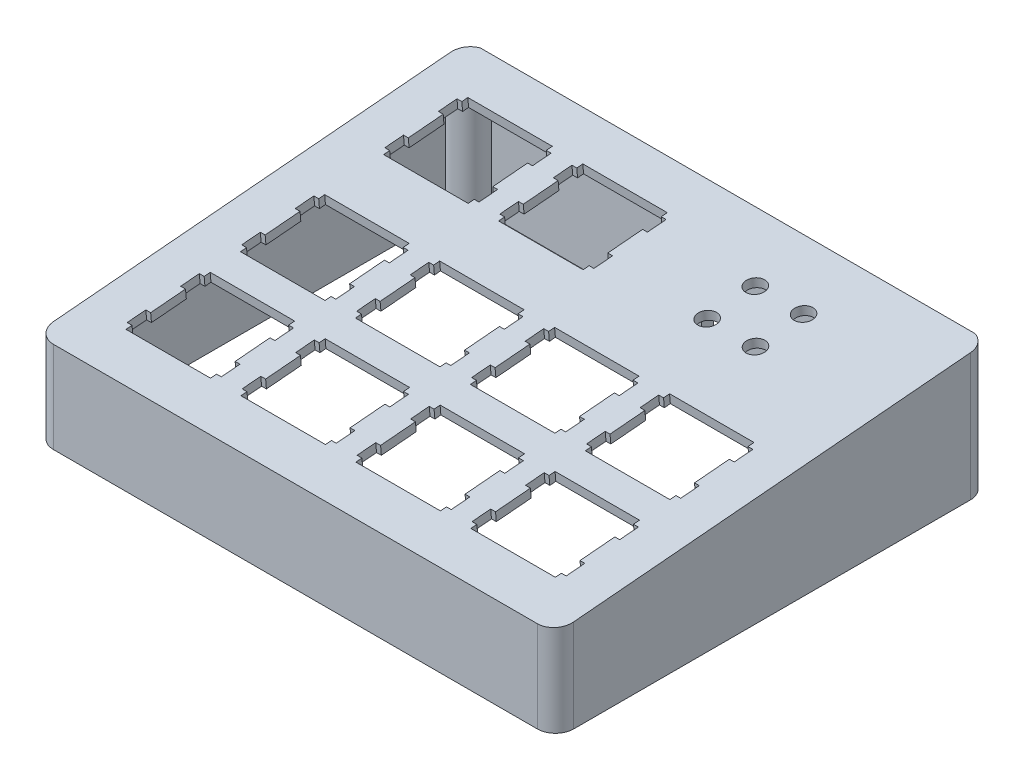
from build123d import *

# Parameters (mm, degrees)
SKETCH2_W                     = 86.201
SKETCH2_H                     = 71.913
BOSS_EXTRUDE1_DEPTH           = 0.75
CUT_EXTRUDE1_REACH            = 58.316
SKETCH7_R                     = 1.5635
EXTRUDE_THIN1_REACH           = 62.021
SKETCH3_W                     = 86.201
SKETCH3_H                     = 71.770082938
SKETCH3_W_2                   = 82.201
SKETCH3_H_2                   = 67.770082938
FILLET1_R                     = 3
BOSS_EXTRUDE2_REACH           = 62.021
SKETCH4_R                     = 3
TAP_DRILL_FOR_2_56_TAP1_D     = 1.778
TAP_DRILL_FOR_2_56_TAP1_DEPTH = 12.7
TAP_DRILL_FOR_2_56_TAP1_TIP   = 0.53416509
CUT_EXTRUDE2_REACH            = 87.527


with BuildPart() as part:
    # Sketch2 → Boss-Extrude1 (new, symmetric)
    with BuildSketch(Plane(origin=(0, 0, 0), x_dir=(1, 0, 0), z_dir=(0, 0.9961946980917455, 0.08715574274765836))):
        Rectangle(SKETCH2_W, SKETCH2_H)
    extrude(amount=BOSS_EXTRUDE1_DEPTH, both=True)

    # Sketch7 → Cut-Extrude1 (cut, up to next)
    with BuildSketch(Plane(origin=(0, 0.747146024, 0.065366807), x_dir=(1, 0, 0), z_dir=(0, 0.9961946980917457, 0.08715574274765837)), mode=Mode.PRIVATE) as cut_extrude1_sk1:
        Polygon((16.524502256, -15.430498458), (16.524502256, -14.43049843), (2.52450187, -14.43049843), (2.52450187, -15.430498458), (1.724502611, -15.430498458), (1.724502611, -18.530497017), (2.52450187, -18.530497017), (2.52450187, -24.330500229), (1.724502611, -24.330500229), (1.724502611, -27.430498788), (2.52450187, -27.430498788), (2.52450187, -28.430498816), (16.524502256, -28.430498816), (16.524502256, -27.430498788), (17.32450533, -27.430498788), (17.32450533, -24.330500229), (16.524502256, -24.330500229), (16.524502256, -18.530497017), (17.32450533, -18.530497017), (17.32450533, -15.430498458), align=None)
    cut_extrude1_tool1 = extrude(cut_extrude1_sk1.sketch, amount=-CUT_EXTRUDE1_REACH, mode=Mode.PRIVATE) & part.part
    # Sketch7 → Cut-Extrude1 (cut, up to next)
    with BuildSketch(Plane(origin=(0, 0.747146024, 0.065366807), x_dir=(1, 0, 0), z_dir=(0, 0.9961946980917457, 0.08715574274765837)), mode=Mode.PRIVATE) as cut_extrude1_sk2:
        Polygon((35.574505833, -15.430498458), (35.574505833, -14.43049843), (21.574505447, -14.43049843), (21.574505447, -15.430498458), (20.774502373, -15.430498458), (20.774502373, -18.530497017), (21.574505447, -18.530497017), (21.574505447, -24.330500229), (20.774502373, -24.330500229), (20.774502373, -27.430498788), (21.574505447, -27.430498788), (21.574505447, -28.430498816), (35.574505833, -28.430498816), (35.574505833, -27.430498788), (36.374501277, -27.430498788), (36.374501277, -24.330500229), (35.574505833, -24.330500229), (35.574505833, -18.530497017), (36.374501277, -18.530497017), (36.374501277, -15.430498458), align=None)
    cut_extrude1_tool2 = extrude(cut_extrude1_sk2.sketch, amount=-CUT_EXTRUDE1_REACH, mode=Mode.PRIVATE) & part.part
    # Sketch7 → Cut-Extrude1 (cut, up to next)
    with BuildSketch(Plane(origin=(0, 0.747146024, 0.065366807), x_dir=(1, 0, 0), z_dir=(0, 0.9961946980917457, 0.08715574274765837)), mode=Mode.PRIVATE) as cut_extrude1_sk3:
        Polygon((16.524502256, 3.619501305), (16.524502256, 4.619501332), (2.52450187, 4.619501332), (2.52450187, 3.619501305), (1.724502611, 3.619501305), (1.724502611, 0.519502745), (2.52450187, 0.519502745), (2.52450187, -5.280496652), (1.724502611, -5.280496652), (1.724502611, -8.380499026), (2.52450187, -8.380499026), (2.52450187, -9.380499054), (16.524502256, -9.380499054), (16.524502256, -8.380499026), (17.32450533, -8.380499026), (17.32450533, -5.280496652), (16.524502256, -5.280496652), (16.524502256, 0.519502745), (17.32450533, 0.519502745), (17.32450533, 3.619501305), align=None)
    cut_extrude1_tool3 = extrude(cut_extrude1_sk3.sketch, amount=-CUT_EXTRUDE1_REACH, mode=Mode.PRIVATE) & part.part
    # Sketch7 → Cut-Extrude1 (cut, up to next)
    with BuildSketch(Plane(origin=(0, 0.747146024, 0.065366807), x_dir=(1, 0, 0), z_dir=(0, 0.9961946980917457, 0.08715574274765837)), mode=Mode.PRIVATE) as cut_extrude1_sk4:
        Polygon((-2.525497506, -15.430498458), (-2.525497506, -14.43049843), (-16.525497892, -14.43049843), (-16.525497892, -15.430498458), (-17.325499059, -15.430498458), (-17.325499059, -18.530497017), (-16.525497892, -18.530497017), (-16.525497892, -24.330500229), (-17.325499059, -24.330500229), (-17.325499059, -27.430498788), (-16.525497892, -27.430498788), (-16.525497892, -28.430498816), (-2.525497506, -28.430498816), (-2.525497506, -27.430498788), (-1.725498247, -27.430498788), (-1.725498247, -24.330500229), (-2.525497506, -24.330500229), (-2.525497506, -18.530497017), (-1.725498247, -18.530497017), (-1.725498247, -15.430498458), align=None)
    cut_extrude1_tool4 = extrude(cut_extrude1_sk4.sketch, amount=-CUT_EXTRUDE1_REACH, mode=Mode.PRIVATE) & part.part
    # Sketch7 → Cut-Extrude1 (cut, up to next)
    with BuildSketch(Plane(origin=(0, 0.747146024, 0.065366807), x_dir=(1, 0, 0), z_dir=(0, 0.9961946980917457, 0.08715574274765837)), mode=Mode.PRIVATE) as cut_extrude1_sk5:
        Polygon((-2.525497506, 3.619501305), (-2.525497506, 4.619501332), (-16.525497892, 4.619501332), (-16.525497892, 3.619501305), (-17.325499059, 3.619501305), (-17.325499059, 0.519502745), (-16.525497892, 0.519502745), (-16.525497892, -5.280496652), (-17.325499059, -5.280496652), (-17.325499059, -8.380499026), (-16.525497892, -8.380499026), (-16.525497892, -9.380499054), (-2.525497506, -9.380499054), (-2.525497506, -8.380499026), (-1.725498247, -8.380499026), (-1.725498247, -5.280496652), (-2.525497506, -5.280496652), (-2.525497506, 0.519502745), (-1.725498247, 0.519502745), (-1.725498247, 3.619501305), align=None)
    cut_extrude1_tool5 = extrude(cut_extrude1_sk5.sketch, amount=-CUT_EXTRUDE1_REACH, mode=Mode.PRIVATE) & part.part
    # Sketch7 → Cut-Extrude1 (cut, up to next)
    with BuildSketch(Plane(origin=(0, 0.747146024, 0.065366807), x_dir=(1, 0, 0), z_dir=(0, 0.9961946980917457, 0.08715574274765837)), mode=Mode.PRIVATE) as cut_extrude1_sk6:
        Polygon((-21.575499176, -15.430498458), (-21.575499176, -14.43049843), (-35.576499012, -14.43049843), (-35.576499012, -15.430498458), (-36.376499225, -15.430498458), (-36.376499225, -18.530497017), (-35.576499012, -18.530497017), (-35.576499012, -24.330500229), (-36.376499225, -24.330500229), (-36.376499225, -27.430498788), (-35.576499012, -27.430498788), (-35.576499012, -28.430498816), (-21.575499176, -28.430498816), (-21.575499176, -27.430498788), (-20.775498009, -27.430498788), (-20.775498009, -24.330500229), (-21.575499176, -24.330500229), (-21.575499176, -18.530497017), (-20.775498009, -18.530497017), (-20.775498009, -15.430498458), align=None)
    cut_extrude1_tool6 = extrude(cut_extrude1_sk6.sketch, amount=-CUT_EXTRUDE1_REACH, mode=Mode.PRIVATE) & part.part
    # Sketch7 → Cut-Extrude1 (cut, up to next)
    with BuildSketch(Plane(origin=(0, 0.747146024, 0.065366807), x_dir=(1, 0, 0), z_dir=(0, 0.9961946980917457, 0.08715574274765837)), mode=Mode.PRIVATE) as cut_extrude1_sk7:
        Polygon((-21.575499176, 3.619501305), (-21.575499176, 4.619501332), (-35.576499012, 4.619501332), (-35.576499012, 3.619501305), (-36.376499225, 3.619501305), (-36.376499225, 0.519502745), (-35.576499012, 0.519502745), (-35.576499012, -5.280496652), (-36.376499225, -5.280496652), (-36.376499225, -8.380499026), (-35.576499012, -8.380499026), (-35.576499012, -9.380499054), (-21.575499176, -9.380499054), (-21.575499176, -8.380499026), (-20.775498009, -8.380499026), (-20.775498009, -5.280496652), (-21.575499176, -5.280496652), (-21.575499176, 0.519502745), (-20.775498009, 0.519502745), (-20.775498009, 3.619501305), align=None)
    cut_extrude1_tool7 = extrude(cut_extrude1_sk7.sketch, amount=-CUT_EXTRUDE1_REACH, mode=Mode.PRIVATE) & part.part
    # Sketch7 → Cut-Extrude1 (cut, up to next)
    with BuildSketch(Plane(origin=(0, 0.747146024, 0.065366807), x_dir=(1, 0, 0), z_dir=(0, 0.9961946980917457, 0.08715574274765837)), mode=Mode.PRIVATE) as cut_extrude1_sk8:
        Polygon((35.574505833, 3.619501305), (35.574505833, 4.619501332), (21.574505447, 4.619501332), (21.574505447, 3.619501305), (20.774502373, 3.619501305), (20.774502373, 0.519502745), (21.574505447, 0.519502745), (21.574505447, -5.280496652), (20.774502373, -5.280496652), (20.774502373, -8.380499026), (21.574505447, -8.380499026), (21.574505447, -9.380499054), (35.574505833, -9.380499054), (35.574505833, -8.380499026), (36.374501277, -8.380499026), (36.374501277, -5.280496652), (35.574505833, -5.280496652), (35.574505833, 0.519502745), (36.374501277, 0.519502745), (36.374501277, 3.619501305), align=None)
    cut_extrude1_tool8 = extrude(cut_extrude1_sk8.sketch, amount=-CUT_EXTRUDE1_REACH, mode=Mode.PRIVATE) & part.part
    # Sketch7 → Cut-Extrude1 (cut, up to next)
    with BuildSketch(Plane(origin=(0, 0.747146024, 0.065366807), x_dir=(1, 0, 0), z_dir=(0, 0.9961946980917457, 0.08715574274765837)), mode=Mode.PRIVATE) as cut_extrude1_sk9:
        Polygon((-21.575499176, 27.432503594), (-21.575499176, 28.432503621), (-35.576499012, 28.432503621), (-35.576499012, 27.432503594), (-36.376499225, 27.432503594), (-36.376499225, 24.331503676), (-35.576499012, 24.331503676), (-35.576499012, 18.53250373), (-36.376499225, 18.53250373), (-36.376499225, 15.431503812), (-35.576499012, 15.431503812), (-35.576499012, 14.431503785), (-21.575499176, 14.431503785), (-21.575499176, 15.431503812), (-20.775498009, 15.431503812), (-20.775498009, 18.53250373), (-21.575499176, 18.53250373), (-21.575499176, 24.331503676), (-20.775498009, 24.331503676), (-20.775498009, 27.432503594), align=None)
    cut_extrude1_tool9 = extrude(cut_extrude1_sk9.sketch, amount=-CUT_EXTRUDE1_REACH, mode=Mode.PRIVATE) & part.part
    # Sketch7 → Cut-Extrude1 (cut, up to next)
    with BuildSketch(Plane(origin=(0, 0.747146024, 0.065366807), x_dir=(1, 0, 0), z_dir=(0, 0.9961946980917457, 0.08715574274765837)), mode=Mode.PRIVATE) as cut_extrude1_sk10:
        Polygon((-2.525497506, 27.432503594), (-2.525497506, 28.432503621), (-16.525497892, 28.432503621), (-16.525497892, 27.432503594), (-17.325499059, 27.432503594), (-17.325499059, 24.331503676), (-16.525497892, 24.331503676), (-16.525497892, 18.53250373), (-17.325499059, 18.53250373), (-17.325499059, 15.431503812), (-16.525497892, 15.431503812), (-16.525497892, 14.431503785), (-2.525497506, 14.431503785), (-2.525497506, 15.431503812), (-1.725498247, 15.431503812), (-1.725498247, 18.53250373), (-2.525497506, 18.53250373), (-2.525497506, 24.331503676), (-1.725498247, 24.331503676), (-1.725498247, 27.432503594), align=None)
    cut_extrude1_tool10 = extrude(cut_extrude1_sk10.sketch, amount=-CUT_EXTRUDE1_REACH, mode=Mode.PRIVATE) & part.part
    # Sketch7 → Cut-Extrude1 (cut, up to next)
    with BuildSketch(Plane(origin=(0, 0.747146024, 0.065366807), x_dir=(1, 0, 0), z_dir=(0, 0.9961946980917457, 0.08715574274765837)), mode=Mode.PRIVATE) as cut_extrude1_sk11:
        with Locations(Location((15.049503239, 17.432003703, 0), (0, 0, 270))):
            Circle(SKETCH7_R)
    cut_extrude1_tool11 = extrude(cut_extrude1_sk11.sketch, amount=-CUT_EXTRUDE1_REACH, mode=Mode.PRIVATE) & part.part
    # Sketch7 → Cut-Extrude1 (cut, up to next)
    with BuildSketch(Plane(origin=(0, 0.747146024, 0.065366807), x_dir=(1, 0, 0), z_dir=(0, 0.9961946980917457, 0.08715574274765837)), mode=Mode.PRIVATE) as cut_extrude1_sk12:
        with Locations(Location((15.049503239, 25.432003703, 0), (0, 0, 270))):
            Circle(SKETCH7_R)
    cut_extrude1_tool12 = extrude(cut_extrude1_sk12.sketch, amount=-CUT_EXTRUDE1_REACH, mode=Mode.PRIVATE) & part.part
    # Sketch7 → Cut-Extrude1 (cut, up to next)
    with BuildSketch(Plane(origin=(0, 0.747146024, 0.065366807), x_dir=(1, 0, 0), z_dir=(0, 0.9961946980917457, 0.08715574274765837)), mode=Mode.PRIVATE) as cut_extrude1_sk13:
        with Locations(Location((23.049503239, 25.432003703, 0), (0, 0, 270))):
            Circle(SKETCH7_R)
    cut_extrude1_tool13 = extrude(cut_extrude1_sk13.sketch, amount=-CUT_EXTRUDE1_REACH, mode=Mode.PRIVATE) & part.part
    # Sketch7 → Cut-Extrude1 (cut, up to next)
    with BuildSketch(Plane(origin=(0, 0.747146024, 0.065366807), x_dir=(1, 0, 0), z_dir=(0, 0.9961946980917457, 0.08715574274765837)), mode=Mode.PRIVATE) as cut_extrude1_sk14:
        with Locations(Location((23.049503239, 17.432003703, 0), (0, 0, 270))):
            Circle(SKETCH7_R)
    cut_extrude1_tool14 = extrude(cut_extrude1_sk14.sketch, amount=-CUT_EXTRUDE1_REACH, mode=Mode.PRIVATE) & part.part
    add(cut_extrude1_tool1.solids().sort_by_distance((9.524503, -1.120645, 21.414316))[0], mode=Mode.SUBTRACT)
    add(cut_extrude1_tool2.solids().sort_by_distance((28.574504, -1.120645, 21.414316))[0], mode=Mode.SUBTRACT)
    add(cut_extrude1_tool3.solids().sort_by_distance((9.524503, 0.539672, 2.436807))[0], mode=Mode.SUBTRACT)
    add(cut_extrude1_tool4.solids().sort_by_distance((-9.525498, -1.120645, 21.414316))[0], mode=Mode.SUBTRACT)
    add(cut_extrude1_tool5.solids().sort_by_distance((-9.525498, 0.539672, 2.436807))[0], mode=Mode.SUBTRACT)
    add(cut_extrude1_tool6.solids().sort_by_distance((-28.575999, -1.120645, 21.414316))[0], mode=Mode.SUBTRACT)
    add(cut_extrude1_tool7.solids().sort_by_distance((-28.575999, 0.539672, 2.436807))[0], mode=Mode.SUBTRACT)
    add(cut_extrude1_tool8.solids().sort_by_distance((28.574504, 0.539672, 2.436807))[0], mode=Mode.SUBTRACT)
    add(cut_extrude1_tool9.solids().sort_by_distance((-28.575999, 2.615068, -21.285082))[0], mode=Mode.SUBTRACT)
    add(cut_extrude1_tool10.solids().sort_by_distance((-9.525498, 2.615068, -21.285082))[0], mode=Mode.SUBTRACT)
    add(cut_extrude1_tool11.solids().sort_by_distance((15.049503, 2.266445, -17.300303))[0], mode=Mode.SUBTRACT)
    add(cut_extrude1_tool12.solids().sort_by_distance((15.049503, 2.963691, -25.26986))[0], mode=Mode.SUBTRACT)
    add(cut_extrude1_tool13.solids().sort_by_distance((23.049503, 2.963691, -25.26986))[0], mode=Mode.SUBTRACT)
    add(cut_extrude1_tool14.solids().sort_by_distance((23.049503, 2.266445, -17.300303))[0], mode=Mode.SUBTRACT)

    # Sketch3 → Extrude-Thin1 (add, up to next)
    with BuildSketch(Plane(origin=(0, -17.5, 0), x_dir=(-1, 0, 0), z_dir=(0, -1, 0)), mode=Mode.PRIVATE) as extrude_thin1_sk1:
        Rectangle(SKETCH3_W, SKETCH3_H)
        Rectangle(SKETCH3_W_2, SKETCH3_H_2, mode=Mode.SUBTRACT)
    extrude_thin1_tool1 = extrude(extrude_thin1_sk1.sketch, amount=-EXTRUDE_THIN1_REACH, mode=Mode.PRIVATE) - part.part
    add(extrude_thin1_tool1.solids().sort_by_distance((0, -17.5, 34.763366))[0])

    # Fillet1
    # the kernel refuses this fillet: 3 mm, written as the material it takes off along each edge
    with BuildSketch(Plane(origin=(43.1005, -25, -35.885041469), x_dir=(0, 0, 1), z_dir=(0, 1, 0))) as fillet1_piece_1:
        with BuildLine():
            CenterArc((FILLET1_R, -FILLET1_R), FILLET1_R, 90, 90)
            Line((0, -FILLET1_R), (0, 0))
            Line((0, 0), (FILLET1_R, 0))
        make_face()
    extrude(amount=34.886669441, mode=Mode.SUBTRACT)
    with BuildSketch(Plane(origin=(-43.1005, -25, -35.885041469), x_dir=(0, 0, 1), z_dir=(0, 1, 0))) as fillet1_piece_2:
        with BuildLine():
            CenterArc((FILLET1_R, FILLET1_R), FILLET1_R, 180, 90)
            Line((0, FILLET1_R), (0, 0))
            Line((0, 0), (FILLET1_R, 0))
        make_face()
    extrude(amount=34.886669441, mode=Mode.SUBTRACT)
    with BuildSketch(Plane(origin=(43.1005, -25, 35.885041469), x_dir=(-1, 0, 0), z_dir=(0, 1, 0))) as fillet1_piece_3:
        with BuildLine():
            CenterArc((FILLET1_R, -FILLET1_R), FILLET1_R, 90, 90)
            Line((0, -FILLET1_R), (0, 0))
            Line((0, 0), (FILLET1_R, 0))
        make_face()
    extrude(amount=30.113330559, mode=Mode.SUBTRACT)
    with BuildSketch(Plane(origin=(-43.1005, -25, 35.885041469), x_dir=(1, 0, 0), z_dir=(0, 1, 0))) as fillet1_piece_4:
        with BuildLine():
            CenterArc((FILLET1_R, FILLET1_R), FILLET1_R, 180, 90)
            Line((0, FILLET1_R), (0, 0))
            Line((0, 0), (FILLET1_R, 0))
        make_face()
    extrude(amount=30.113330559, mode=Mode.SUBTRACT)

    # Boss-Extrude2: up to this plane
    boss_extrude2_end = Plane(origin=(0, -0.747146024, -0.065366807), z_dir=(0, -0.9961946980917455, -0.08715574274765836))
    # Sketch4 → Boss-Extrude2 (add, up to the surface)
    with BuildSketch(Plane.XZ.offset(17.5), mode=Mode.PRIVATE) as boss_extrude2_sk1:
        with Locations((-40.1005, 32.885041469)):
            Circle(SKETCH4_R)
    boss_extrude2_tool1 = split(extrude(boss_extrude2_sk1.sketch, amount=-BOSS_EXTRUDE2_REACH, mode=Mode.PRIVATE), bisect_by=boss_extrude2_end, keep=Keep.BOTH, mode=Mode.PRIVATE)
    add(boss_extrude2_tool1.solids().sort_by_distance((-40.1005, -17.5, 32.885041))[0])
    # Sketch4 → Boss-Extrude2 (add, up to the surface)
    with BuildSketch(Plane.XZ.offset(17.5), mode=Mode.PRIVATE) as boss_extrude2_sk2:
        with Locations((40.1005, 32.885041469)):
            Circle(SKETCH4_R)
    boss_extrude2_tool2 = split(extrude(boss_extrude2_sk2.sketch, amount=-BOSS_EXTRUDE2_REACH, mode=Mode.PRIVATE), bisect_by=boss_extrude2_end, keep=Keep.BOTH, mode=Mode.PRIVATE)
    add(boss_extrude2_tool2.solids().sort_by_distance((40.1005, -17.5, 32.885041))[0])
    # Sketch4 → Boss-Extrude2 (add, up to the surface)
    with BuildSketch(Plane.XZ.offset(17.5), mode=Mode.PRIVATE) as boss_extrude2_sk3:
        with Locations((40.1005, -32.885041469)):
            Circle(SKETCH4_R)
    boss_extrude2_tool3 = split(extrude(boss_extrude2_sk3.sketch, amount=-BOSS_EXTRUDE2_REACH, mode=Mode.PRIVATE), bisect_by=boss_extrude2_end, keep=Keep.BOTH, mode=Mode.PRIVATE)
    add(boss_extrude2_tool3.solids().sort_by_distance((40.1005, -17.5, -32.885041))[0])
    # Sketch4 → Boss-Extrude2 (add, up to the surface)
    with BuildSketch(Plane.XZ.offset(17.5), mode=Mode.PRIVATE) as boss_extrude2_sk4:
        with Locations((-40.1005, -32.885041469)):
            Circle(SKETCH4_R)
    boss_extrude2_tool4 = split(extrude(boss_extrude2_sk4.sketch, amount=-BOSS_EXTRUDE2_REACH, mode=Mode.PRIVATE), bisect_by=boss_extrude2_end, keep=Keep.BOTH, mode=Mode.PRIVATE)
    add(boss_extrude2_tool4.solids().sort_by_distance((-40.1005, -17.5, -32.885041))[0])

    # Tap Drill for #2-56 Tap1
    with Locations(Plane(origin=(0, -17.5, 0), x_dir=(-1, 0, 0), z_dir=(0, -1, 0))):
        with Locations((40.1005, -32.885041469), (-40.1005, -32.885041469), (-40.1005, 32.885041469), (40.1005, 32.885041469)):
            Hole(TAP_DRILL_FOR_2_56_TAP1_D / 2, depth=TAP_DRILL_FOR_2_56_TAP1_DEPTH)
            with Locations((0, 0, -(TAP_DRILL_FOR_2_56_TAP1_DEPTH + TAP_DRILL_FOR_2_56_TAP1_TIP / 2))):  # 118° drill point
                Cone(0, TAP_DRILL_FOR_2_56_TAP1_D / 2, TAP_DRILL_FOR_2_56_TAP1_TIP, mode=Mode.SUBTRACT)

    # Sketch8 → Cut-Extrude2 (cut, up to next)
    with BuildSketch(Plane(origin=(0, 0, -35.885041469), x_dir=(-1, 0, 0), z_dir=(0, 0, -1)), mode=Mode.PRIVATE) as cut_extrude2_sk1:
        with BuildLine():
            Line((-2.5, -15), (-2.5, -17.5))
            Line((-2.5, -17.5), (2.5, -17.5))
            Line((2.5, -17.5), (2.5, -15))
            ThreePointArc((2.5, -15), (0, -12.5), (-2.5, -15))
        make_face()
    cut_extrude2_tool1 = extrude(cut_extrude2_sk1.sketch, amount=-CUT_EXTRUDE2_REACH, mode=Mode.PRIVATE) & part.part
    add(cut_extrude2_tool1.solids().sort_by_distance((0, -15.233375, -35.885041))[0], mode=Mode.SUBTRACT)


solid = part.part
